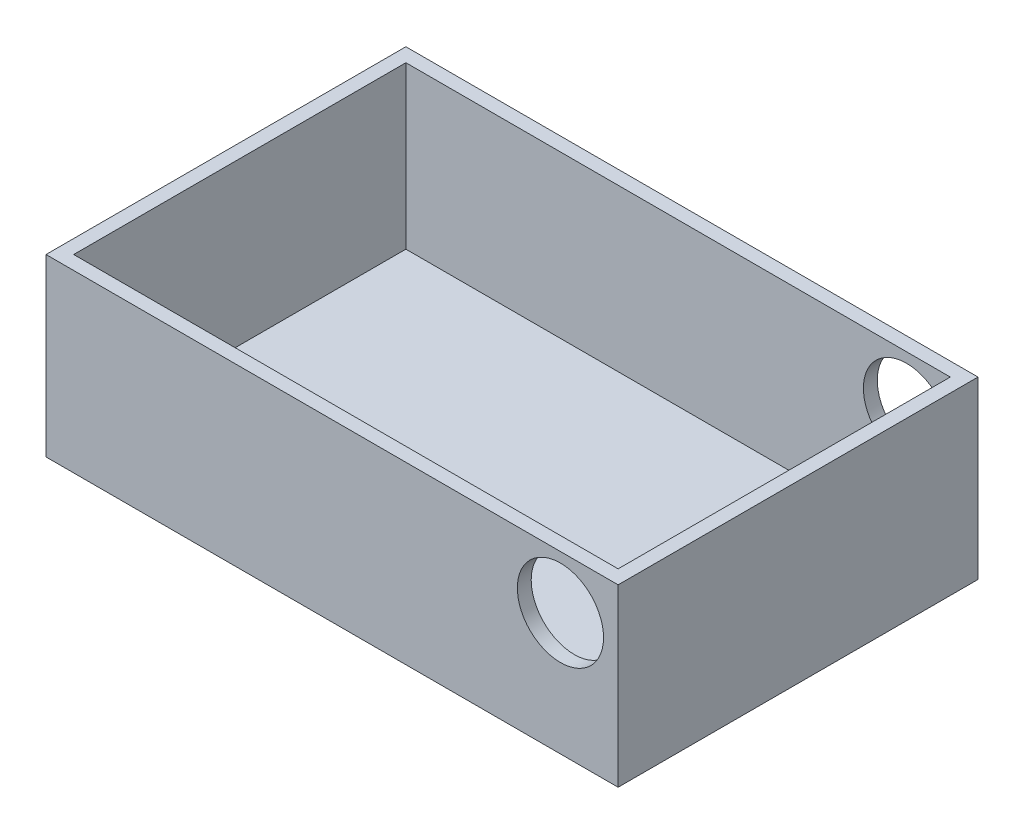
from build123d import *

# Parameters (mm, degrees)
SKETCH1_W           = 787.4
SKETCH1_H           = 495.3
BOSS_EXTRUDE1_DEPTH = 241.3
SHELL1_T            = -19.05
SKETCH2_R           = 59.309
CUT_EXTRUDE1_DEPTH  = 962.01328815


with BuildPart() as part:
    # Sketch1 → Boss-Extrude1 (new body)
    with BuildSketch(Plane(origin=(0, 0, 0), x_dir=(1, 0, 0), z_dir=(0, 1, 0))):
        with Locations((393.7, 247.65)):
            Rectangle(SKETCH1_W, SKETCH1_H)
    extrude(amount=BOSS_EXTRUDE1_DEPTH)

    # Shell1
    shell1_openings = [part.faces().sort_by_distance(p)[0] for p in [
        (393.7, 241.3, -247.65),
    ]]
    offset(amount=SHELL1_T, openings=shell1_openings, kind=Kind.INTERSECTION)

    # Sketch2 → Cut-Extrude1 (cut, through all)
    with BuildSketch(Plane.XY):
        with Locations((708.025, 168.275)):
            Circle(SKETCH2_R)
    extrude(amount=-CUT_EXTRUDE1_DEPTH, mode=Mode.SUBTRACT)


solid = part.part
